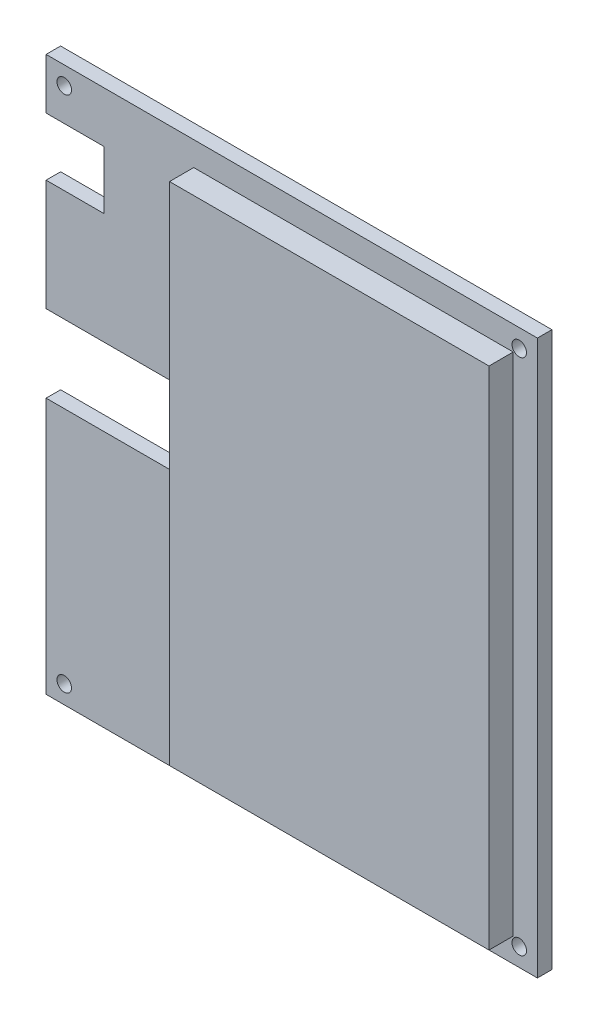
from build123d import *

# Parameters (mm, degrees)
SKETCH1_R           = 1.5
BOSS_EXTRUDE1_DEPTH = 3
SKETCH2_W           = 66
SKETCH2_H           = 104.5
BOSS_EXTRUDE2_DEPTH = 8


with BuildPart() as part:
    # Sketch1 → Boss-Extrude1 (new body)
    with BuildSketch(Plane(origin=(0, 0, 0), x_dir=(-1, 0, 0), z_dir=(0, 0, 1))):
        Polygon((50.75, 4.25), (50.75, 10.25), (50.75, 25.25), (50.75, 33.25), (50.75, 48.25), (50.75, 57.25), (-50.75, 57.25), (-50.75, -14.25), (-50.75, -41.25), (-50.75, -57.25), (-43.25, -57.25), (-13.25, -57.25), (-5.25, -57.25), (14.75, -57.25), (21.75, -57.25), (29.75, -57.25), (50.75, -57.25), (50.75, -46.75), (38.75, -46.75), (38.75, -34.75), (50.75, -34.75), (50.75, -29.75), (50.75, -20.75), (50.75, -11.75), (25.25, -11.75), (25.25, 4.25), align=None)
        with Locations((-47, -53.5)):
            Circle(SKETCH1_R, mode=Mode.SUBTRACT)
        with Locations((47, -53.5)):
            Circle(SKETCH1_R, mode=Mode.SUBTRACT)
        with Locations((-47, 53.5)):
            Circle(SKETCH1_R, mode=Mode.SUBTRACT)
        with Locations((47, 53.5)):
            Circle(SKETCH1_R, mode=Mode.SUBTRACT)
    extrude(amount=BOSS_EXTRUDE1_DEPTH)

    # Sketch2 → Boss-Extrude2 (add)
    with BuildSketch(Plane(origin=(0, 0, 0), x_dir=(-1, 0, 0), z_dir=(0, 0, -1))):
        with Locations((-12.75, 0)):
            Rectangle(SKETCH2_W, SKETCH2_H)
    extrude(amount=-BOSS_EXTRUDE2_DEPTH)


solid = part.part
